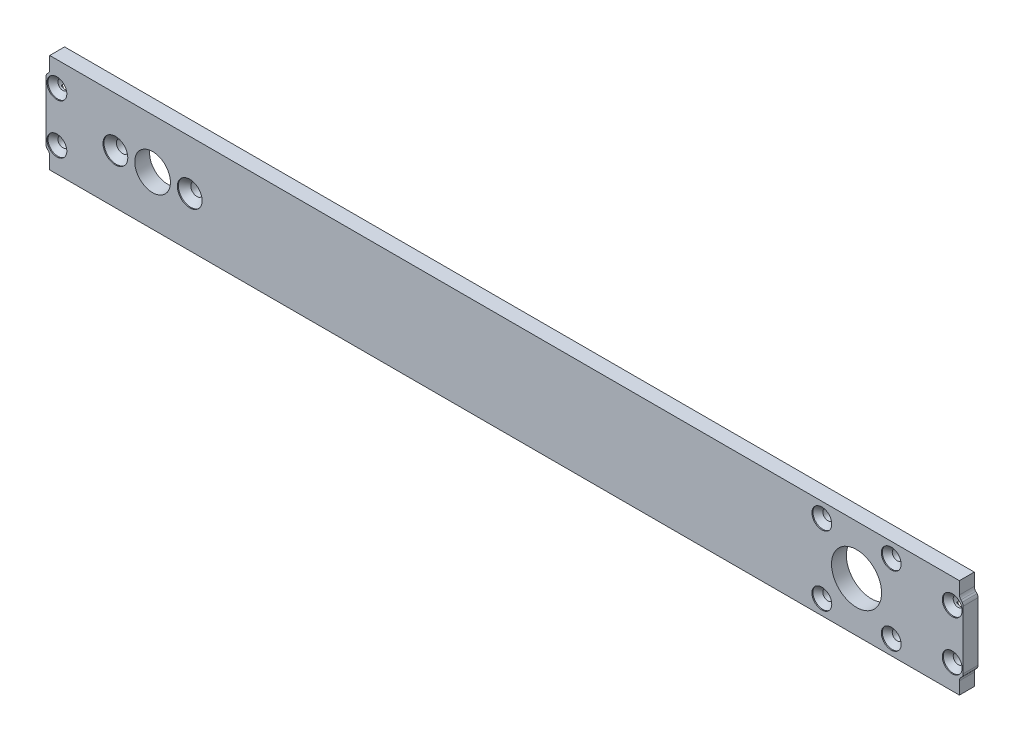
from build123d import *
from build123d.topology import SkipClean

# Parameters (mm, degrees)
SKETCH1_W                    = 185
SKETCH1_H                    = 20
BASE_SHAPE_DEPTH             = 3
MOTOR_CUTOUTS_REACH          = 95.087
SKETCH2_R                    = 1.25
SKETCH2_R_2                  = 3.6
SKETCH2_R_3                  = 5.05
SKETCH2_R_4                  = 1
PCB_SLOT_DEPTH               = 0.775
END_PLATE_HOLES_REACH        = 95.087
SKETCH6_R                    = 1
M2_5_COUNTERSUNKS_AT_2_COUNT = 2
M2_5_COUNTERSUNKS_AT_2_PITCH = 15
M2_COUNTERSUNKS_AT_2_COUNT   = 2
M2_COUNTERSUNKS_AT_2_PITCH   = 10
M2_COUNTERSUNKS_AT_3_COUNT   = 2
M2_COUNTERSUNKS_AT_3_PITCH   = 180.6
M2_COUNTERSUNKS_AT_4_COUNT   = 2
M2_COUNTERSUNKS_AT_4_PITCH   = 180.876643047
M2_COUNTERSUNKS_AT_5_COUNT   = 2
M2_COUNTERSUNKS_AT_5_PITCH   = 17.18400419
M2_COUNTERSUNKS_AT_6_COUNT   = 2
M2_COUNTERSUNKS_AT_6_PITCH   = 28.908303305
M2_COUNTERSUNKS_AT_7_COUNT   = 2
M2_COUNTERSUNKS_AT_7_PITCH   = 26.375936002
M2_COUNTERSUNKS_AT_8_COUNT   = 2
M2_COUNTERSUNKS_AT_8_PITCH   = 12.461540836
TAP_START                    = -1.4
TAP_SLOTS_DEPTH              = 1.4
CUT_EXTRUDE3_REACH           = 95.087
FILLET1_R                    = 1


with BuildPart() as part:
    # Sketch1 → Base shape (new body)
    with BuildSketch(Plane.XY):
        Rectangle(SKETCH1_W, SKETCH1_H)
    extrude(amount=-BASE_SHAPE_DEPTH)

    # Sketch2 → Motor cutouts (cut, up to next)
    with BuildSketch(Plane.XY, mode=Mode.PRIVATE) as motor_cutouts_sk1:
        with Locations((-78.5, 0)):
            Circle(SKETCH2_R)
    motor_cutouts_tool1 = extrude(motor_cutouts_sk1.sketch, amount=-MOTOR_CUTOUTS_REACH, mode=Mode.PRIVATE) & part.part
    # Sketch2 → Motor cutouts (cut, up to next)
    with BuildSketch(Plane.XY, mode=Mode.PRIVATE) as motor_cutouts_sk2:
        with Locations((-63.5, 0)):
            Circle(SKETCH2_R)
    motor_cutouts_tool2 = extrude(motor_cutouts_sk2.sketch, amount=-MOTOR_CUTOUTS_REACH, mode=Mode.PRIVATE) & part.part
    # Sketch2 → Motor cutouts (cut, up to next)
    with BuildSketch(Plane.XY, mode=Mode.PRIVATE) as motor_cutouts_sk3:
        with Locations((-71, 0)):
            Circle(SKETCH2_R_2)
    motor_cutouts_tool3 = extrude(motor_cutouts_sk3.sketch, amount=-MOTOR_CUTOUTS_REACH, mode=Mode.PRIVATE) & part.part
    # Sketch2 → Motor cutouts (cut, up to next)
    with BuildSketch(Plane.XY, mode=Mode.PRIVATE) as motor_cutouts_sk4:
        with Locations((71, 0)):
            Circle(SKETCH2_R_3)
    motor_cutouts_tool4 = extrude(motor_cutouts_sk4.sketch, amount=-MOTOR_CUTOUTS_REACH, mode=Mode.PRIVATE) & part.part
    # Sketch2 → Motor cutouts (cut, up to next)
    with BuildSketch(Plane.XY, mode=Mode.PRIVATE) as motor_cutouts_sk5:
        with Locations((64, 7)):
            Circle(SKETCH2_R_4)
    motor_cutouts_tool5 = extrude(motor_cutouts_sk5.sketch, amount=-MOTOR_CUTOUTS_REACH, mode=Mode.PRIVATE) & part.part
    # Sketch2 → Motor cutouts (cut, up to next)
    with BuildSketch(Plane.XY, mode=Mode.PRIVATE) as motor_cutouts_sk6:
        with Locations((78, 7)):
            Circle(SKETCH2_R_4)
    motor_cutouts_tool6 = extrude(motor_cutouts_sk6.sketch, amount=-MOTOR_CUTOUTS_REACH, mode=Mode.PRIVATE) & part.part
    # Sketch2 → Motor cutouts (cut, up to next)
    with BuildSketch(Plane.XY, mode=Mode.PRIVATE) as motor_cutouts_sk7:
        with Locations((78, -7)):
            Circle(SKETCH2_R_4)
    motor_cutouts_tool7 = extrude(motor_cutouts_sk7.sketch, amount=-MOTOR_CUTOUTS_REACH, mode=Mode.PRIVATE) & part.part
    # Sketch2 → Motor cutouts (cut, up to next)
    with BuildSketch(Plane.XY, mode=Mode.PRIVATE) as motor_cutouts_sk8:
        with Locations((64, -7)):
            Circle(SKETCH2_R_4)
    motor_cutouts_tool8 = extrude(motor_cutouts_sk8.sketch, amount=-MOTOR_CUTOUTS_REACH, mode=Mode.PRIVATE) & part.part
    add(motor_cutouts_tool1.solids().sort_by_distance((-78.5, 0, 0))[0], mode=Mode.SUBTRACT)
    add(motor_cutouts_tool2.solids().sort_by_distance((-63.5, 0, 0))[0], mode=Mode.SUBTRACT)
    add(motor_cutouts_tool3.solids().sort_by_distance((-71, 0, 0))[0], mode=Mode.SUBTRACT)
    add(motor_cutouts_tool4.solids().sort_by_distance((71, 0, 0))[0], mode=Mode.SUBTRACT)
    add(motor_cutouts_tool5.solids().sort_by_distance((64, 7, 0))[0], mode=Mode.SUBTRACT)
    add(motor_cutouts_tool6.solids().sort_by_distance((78, 7, 0))[0], mode=Mode.SUBTRACT)
    add(motor_cutouts_tool7.solids().sort_by_distance((78, -7, 0))[0], mode=Mode.SUBTRACT)
    add(motor_cutouts_tool8.solids().sort_by_distance((64, -7, 0))[0], mode=Mode.SUBTRACT)

    # Sketch5 → PCB slot (cut)
    with BuildSketch(Plane(origin=(0, 0, -3), x_dir=(-1, 0, 0), z_dir=(0, 0, -1))):
        with BuildLine():
            Line((-60, -6), (60, -6))
            ThreePointArc((60, -6), (61, -7), (60, -8))
            Line((60, -8), (-60, -8))
            ThreePointArc((-60, -8), (-61, -7), (-60, -6))
        make_face()
    extrude(amount=-PCB_SLOT_DEPTH, mode=Mode.SUBTRACT)

    # Sketch6 → End plate holes (cut, up to next)
    with BuildSketch(Plane.XY, mode=Mode.PRIVATE) as end_plate_holes_sk1:
        with Locations((90.3, 5)):
            Circle(SKETCH6_R)
    end_plate_holes_tool1 = extrude(end_plate_holes_sk1.sketch, amount=-END_PLATE_HOLES_REACH, mode=Mode.PRIVATE) & part.part
    # Sketch6 → End plate holes (cut, up to next)
    with BuildSketch(Plane.XY, mode=Mode.PRIVATE) as end_plate_holes_sk2:
        with Locations((90.3, -5)):
            Circle(SKETCH6_R)
    end_plate_holes_tool2 = extrude(end_plate_holes_sk2.sketch, amount=-END_PLATE_HOLES_REACH, mode=Mode.PRIVATE) & part.part
    # Sketch6 → End plate holes (cut, up to next)
    with BuildSketch(Plane.XY, mode=Mode.PRIVATE) as end_plate_holes_sk3:
        with Locations((-90.3, -5)):
            Circle(SKETCH6_R)
    end_plate_holes_tool3 = extrude(end_plate_holes_sk3.sketch, amount=-END_PLATE_HOLES_REACH, mode=Mode.PRIVATE) & part.part
    # Sketch6 → End plate holes (cut, up to next)
    with BuildSketch(Plane.XY, mode=Mode.PRIVATE) as end_plate_holes_sk4:
        with Locations((-90.3, 5)):
            Circle(SKETCH6_R)
    end_plate_holes_tool4 = extrude(end_plate_holes_sk4.sketch, amount=-END_PLATE_HOLES_REACH, mode=Mode.PRIVATE) & part.part
    add(end_plate_holes_tool1.solids().sort_by_distance((90.3, 5, 0))[0], mode=Mode.SUBTRACT)
    add(end_plate_holes_tool2.solids().sort_by_distance((90.3, -5, 0))[0], mode=Mode.SUBTRACT)
    add(end_plate_holes_tool3.solids().sort_by_distance((-90.3, -5, 0))[0], mode=Mode.SUBTRACT)
    add(end_plate_holes_tool4.solids().sort_by_distance((-90.3, 5, 0))[0], mode=Mode.SUBTRACT)

    # Sketch4 → M2.5 countersunks (revolve, cut)
    with BuildSketch(Plane(origin=(-78.5, 0, 0), x_dir=(0, -1, 0), z_dir=(1, 0, 0))):
        Polygon((0, 0), (0, 3), (1.25, 3), (1.25, 1.45), (2.5, 0.2), (2.5, 0), align=None)
    m2_5_countersunks = revolve(axis=Axis((-78.5, 0, 6.35), (0, 0, -1)), mode=Mode.SUBTRACT)

    # M2.5 countersunks at 2: M2.5 countersunks ×2
    with Locations(*[(i * M2_5_COUNTERSUNKS_AT_2_PITCH, 0, 0) for i in range(1, M2_5_COUNTERSUNKS_AT_2_COUNT)]):
        add(m2_5_countersunks, mode=Mode.SUBTRACT)

    # Sketch9 → M2 countersunks (revolve, cut)
    with BuildSketch(Plane(origin=(90.3, 5, 0), x_dir=(0, -1, 0), z_dir=(1, 0, 0))):
        Polygon((0, 0), (0, 3), (1, 3), (1, 1.2), (2, 0.2), (2, 0), align=None)
    m2_countersunks = revolve(axis=Axis((90.3, 5, 6.35), (0, 0, -1)), mode=Mode.SUBTRACT)

    # M2 countersunks at 2: M2 countersunks ×2
    with Locations(*[(0, -i * M2_COUNTERSUNKS_AT_2_PITCH, 0) for i in range(1, M2_COUNTERSUNKS_AT_2_COUNT)]):
        add(m2_countersunks, mode=Mode.SUBTRACT)

    # M2 countersunks at 3: M2 countersunks ×2
    with Locations(*[(-i * M2_COUNTERSUNKS_AT_3_PITCH, 0, 0) for i in range(1, M2_COUNTERSUNKS_AT_3_COUNT)]):
        add(m2_countersunks, mode=Mode.SUBTRACT)

    # M2 countersunks at 4: M2 countersunks ×2
    with Locations(*[Vector(-0.9984705430039356, -0.055286298062233535, 0) * (i * M2_COUNTERSUNKS_AT_4_PITCH) for i in range(1, M2_COUNTERSUNKS_AT_4_COUNT)]):
        add(m2_countersunks, mode=Mode.SUBTRACT)

    # M2 countersunks at 5: M2 countersunks ×2
    with Locations(*[Vector(-0.7157819483772108, -0.6983238520753275, 0) * (i * M2_COUNTERSUNKS_AT_5_PITCH) for i in range(1, M2_COUNTERSUNKS_AT_5_COUNT)]):
        add(m2_countersunks, mode=Mode.SUBTRACT)

    # M2 countersunks at 6: M2 countersunks ×2
    with Locations(*[Vector(-0.9097732136717974, -0.4151056488236338, 0) * (i * M2_COUNTERSUNKS_AT_6_PITCH) for i in range(1, M2_COUNTERSUNKS_AT_6_COUNT)]):
        add(m2_countersunks, mode=Mode.SUBTRACT)

    # M2 countersunks at 7: M2 countersunks ×2
    with Locations(*[Vector(-0.9971210120337703, 0.07582669293032472, 0) * (i * M2_COUNTERSUNKS_AT_7_PITCH) for i in range(1, M2_COUNTERSUNKS_AT_7_COUNT)]):
        add(m2_countersunks, mode=Mode.SUBTRACT)

    # M2 countersunks at 8: M2 countersunks ×2
    with Locations(*[Vector(-0.9870368489870532, 0.1604937965832608, 0) * (i * M2_COUNTERSUNKS_AT_8_PITCH) for i in range(1, M2_COUNTERSUNKS_AT_8_COUNT)]):
        add(m2_countersunks, mode=Mode.SUBTRACT)

    # Sketch12 → Tap slots (cut)
    with SkipClean():  # the faces are left unmerged after this step: merging them gives an invalid solid
        with BuildSketch(Plane(origin=(0, 0, -3), x_dir=(-1, 0, 0), z_dir=(0, 0, -1)).offset(TAP_START)):
            with BuildLine():
                Line((-91.9, 2.635786438), (-91.9, -2.635786438))
                ThreePointArc((-91.9, -2.635786438), (-92.085607903, -3.793515558), (-91.043923255, -4.33173494))
                ThreePointArc((-91.043923255, -4.33173494), (-91.048881163, -4.337295689), (-91.053797505, -4.342893219))
                Line((-91.053797505, -4.342893219), (-89.546202495, -4.342893219))
                ThreePointArc((-89.546202495, -4.342893219), (-89.551118837, -4.337295689), (-89.556076745, -4.33173494))
                ThreePointArc((-89.556076745, -4.33173494), (-88.514392097, -3.793515558), (-88.7, -2.635786438))
                Line((-88.7, -2.635786438), (-88.7, 2.635786438))
                ThreePointArc((-88.7, 2.635786438), (-88.514392097, 3.793515558), (-89.556076745, 4.33173494))
                ThreePointArc((-89.556076745, 4.33173494), (-89.551118837, 4.337295689), (-89.546202495, 4.342893219))
                Line((-89.546202495, 4.342893219), (-91.053797505, 4.342893219))
                ThreePointArc((-91.053797505, 4.342893219), (-91.048881163, 4.337295689), (-91.043923255, 4.33173494))
                ThreePointArc((-91.043923255, 4.33173494), (-92.085607903, 3.793515558), (-91.9, 2.635786438))
            make_face()
            with BuildLine():
                Line((91.9, -2.635786438), (91.9, 2.635786438))
                ThreePointArc((91.9, 2.635786438), (92.085607903, 3.793515558), (91.043923255, 4.33173494))
                ThreePointArc((91.043923255, 4.33173494), (91.048881163, 4.337295689), (91.053797505, 4.342893219))
                Line((91.053797505, 4.342893219), (89.546202495, 4.342893219))
                ThreePointArc((89.546202495, 4.342893219), (89.551118837, 4.337295689), (89.556076745, 4.33173494))
                ThreePointArc((89.556076745, 4.33173494), (88.514392097, 3.793515558), (88.7, 2.635786438))
                Line((88.7, 2.635786438), (88.7, -2.635786438))
                ThreePointArc((88.7, -2.635786438), (88.514392097, -3.793515558), (89.556076745, -4.33173494))
                ThreePointArc((89.556076745, -4.33173494), (89.551118837, -4.337295689), (89.546202495, -4.342893219))
                Line((89.546202495, -4.342893219), (91.053797505, -4.342893219))
                ThreePointArc((91.053797505, -4.342893219), (91.048881163, -4.337295689), (91.043923255, -4.33173494))
                ThreePointArc((91.043923255, -4.33173494), (92.085607903, -3.793515558), (91.9, -2.635786438))
            make_face()
        extrude(amount=TAP_SLOTS_DEPTH, mode=Mode.SUBTRACT)

    # Sketch13 → Cut-Extrude3 (cut, up to next)
    with BuildSketch(Plane.XY, mode=Mode.PRIVATE) as cut_extrude3_sk1:
        with BuildLine():
            Line((-91.75, 10), (-92.5, 10))
            Line((-92.5, 10), (-92.5, 6.187434209))
            ThreePointArc((-92.5, 6.187434209), (-92.173731748, 6.655031521), (-91.75, 7.036541185))
            Line((-91.75, 7.036541185), (-91.75, 10))
        make_face()
    cut_extrude3_tool1 = extrude(cut_extrude3_sk1.sketch, amount=-CUT_EXTRUDE3_REACH, mode=Mode.PRIVATE) & part.part
    # Sketch13 → Cut-Extrude3 (cut, up to next)
    with BuildSketch(Plane.XY, mode=Mode.PRIVATE) as cut_extrude3_sk2:
        with BuildLine():
            Line((92.5, 10), (91.75, 10))
            Line((91.75, 10), (91.75, 7.036541185))
            ThreePointArc((91.75, 7.036541185), (92.173731748, 6.655031521), (92.5, 6.187434209))
            Line((92.5, 6.187434209), (92.5, 10))
        make_face()
    cut_extrude3_tool2 = extrude(cut_extrude3_sk2.sketch, amount=-CUT_EXTRUDE3_REACH, mode=Mode.PRIVATE) & part.part
    # Sketch13 → Cut-Extrude3 (cut, up to next)
    with BuildSketch(Plane.XY, mode=Mode.PRIVATE) as cut_extrude3_sk3:
        with BuildLine():
            ThreePointArc((-91.75, -7.036541185), (-92.173731748, -6.655031521), (-92.5, -6.187434209))
            Line((-92.5, -6.187434209), (-92.5, -10))
            Line((-92.5, -10), (-91.75, -10))
            Line((-91.75, -10), (-91.75, -7.036541185))
        make_face()
    cut_extrude3_tool3 = extrude(cut_extrude3_sk3.sketch, amount=-CUT_EXTRUDE3_REACH, mode=Mode.PRIVATE) & part.part
    # Sketch13 → Cut-Extrude3 (cut, up to next)
    with BuildSketch(Plane.XY, mode=Mode.PRIVATE) as cut_extrude3_sk4:
        with BuildLine():
            ThreePointArc((92.5, -6.187434209), (92.173731748, -6.655031521), (91.75, -7.036541185))
            Line((91.75, -7.036541185), (91.75, -10))
            Line((91.75, -10), (92.5, -10))
            Line((92.5, -10), (92.5, -6.187434209))
        make_face()
    cut_extrude3_tool4 = extrude(cut_extrude3_sk4.sketch, amount=-CUT_EXTRUDE3_REACH, mode=Mode.PRIVATE) & part.part
    add(cut_extrude3_tool1.solids().sort_by_distance((-92.140588, 8.330084, 0))[0], mode=Mode.SUBTRACT)
    add(cut_extrude3_tool2.solids().sort_by_distance((92.140588, 8.330084, 0))[0], mode=Mode.SUBTRACT)
    add(cut_extrude3_tool3.solids().sort_by_distance((-92.140588, -8.330084, 0))[0], mode=Mode.SUBTRACT)
    add(cut_extrude3_tool4.solids().sort_by_distance((92.140588, -8.330084, 0))[0], mode=Mode.SUBTRACT)

    # Fillet1
    fillet1_edges = [part.edges().sort_by_distance(p)[0] for p in [
        (-91.75, -7.036541185, -1.5),
        (-92.5, -6.187434209, -1.5),
        (-92.5, 6.187434209, -1.5),
        (-91.75, 7.036541185, -1.5),
        (92.5, 6.187434209, -1.5),
        (91.75, 7.036541185, -1.5),
        (92.5, -6.187434209, -1.5),
        (91.75, -7.036541185, -1.5),
    ]]
    fillet(fillet1_edges, radius=FILLET1_R)


solid = part.part
